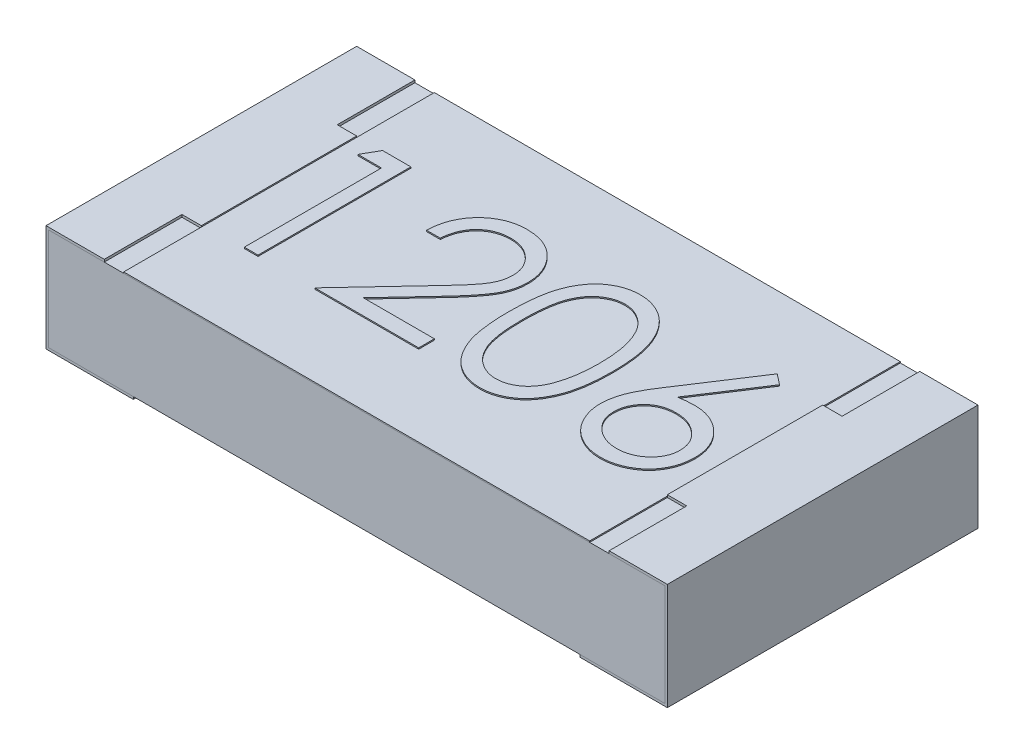
from build123d import *

# Parameters (mm, degrees)
CROQUIS1_W              = 3.2
CROQUIS1_H              = 1.6
SALIENTE_EXTRUIR1_DEPTH = 0.55
CROQUIS2_W              = 2.3
CROQUIS2_H              = 0.0125
CROQUIS2_W_2            = 2.4
CORTAR_EXTRUIR1_DEPTH   = 3.328626204
CROQUIS3_W              = 0.1
CROQUIS3_H              = 0.4
CORTAR_EXTRUIR3_DEPTH   = 0.0125
CROQUIS4_W              = 2.4
CROQUIS4_H              = 1.6
SALIENTE_EXTRUIR2_DEPTH = 0.00625
SALIENTE_EXTRUIR2_TAPER = 1
SALIENTE_EXTRUIR3_START = 0.54375
SALIENTE_EXTRUIR3_DEPTH = 0.00625


# Read off the part's stored shape, not the designer's step: Saliente-Extruir3
with BuildPart() as part:
    # Croquis1 → Saliente-Extruir1 (new body)
    with BuildSketch(Plane(origin=(0, 0, 0), x_dir=(1, 0, 0), z_dir=(0, 1, 0))):
        Rectangle(CROQUIS1_W, CROQUIS1_H)
    extrude(amount=SALIENTE_EXTRUIR1_DEPTH)

    # Croquis2 → Cortar-Extruir1 (cut, through all)
    with BuildSketch(Plane.XY.offset(0.8)):
        with Locations((0, 0.00625)):
            Rectangle(CROQUIS2_W, CROQUIS2_H)
        with Locations((0, 0.54375)):
            Rectangle(CROQUIS2_W_2, CROQUIS2_H)
    extrude(amount=-CORTAR_EXTRUIR1_DEPTH, mode=Mode.SUBTRACT)

    # Croquis3 → Cortar-Extruir3 (cut)
    with BuildSketch(Plane(origin=(0, 0.55, 0), x_dir=(1, 0, 0), z_dir=(0, 1, 0))):
        with Locations((-1.25, -0.6)):
            Rectangle(CROQUIS3_W, CROQUIS3_H)
        with Locations((-1.25, 0.6)):
            Rectangle(CROQUIS3_W, CROQUIS3_H)
        with Locations((1.25, 0.6)):
            Rectangle(CROQUIS3_W, CROQUIS3_H)
        with Locations((1.25, -0.6)):
            Rectangle(CROQUIS3_W, CROQUIS3_H)
    extrude(amount=-CORTAR_EXTRUIR3_DEPTH, mode=Mode.SUBTRACT)

    # Croquis4 → Saliente-Extruir2 (add)
    with BuildSketch(Plane(origin=(0, 0.5375, 0), x_dir=(1, 0, 0), z_dir=(0, 1, 0))):
        Rectangle(CROQUIS4_W, CROQUIS4_H)
    extrude(amount=SALIENTE_EXTRUIR2_DEPTH, taper=SALIENTE_EXTRUIR2_TAPER)

    # Saliente-Extruir3 outline → Saliente-Extruir3 (add)
    # profile 1 of 4: a face of its own
    with BuildSketch(Plane(origin=(0, 0, 0), x_dir=(1, 0, 0), z_dir=(0, 1, 0)).offset(SALIENTE_EXTRUIR3_START)):
        with BuildLine():
            add(Edge.make_bspline(
                [(-0.346873932, 0.341368482), (-0.353028949, 0.341207689), (-0.365116386, 0.340891918), (-0.382863306, 0.338683047), (-0.399793199, 0.33487235), (-0.415948649, 0.329660495), (-0.431356993, 0.323036002), (-0.445943298, 0.314784945), (-0.459674817, 0.30493913), (-0.472577365, 0.293776208), (-0.484465154, 0.281347904), (-0.494909897, 0.267493362), (-0.504036229, 0.252465544), (-0.511998882, 0.236305001), (-0.518465319, 0.218865091), (-0.523406532, 0.200207726), (-0.527316399, 0.180413914), (-0.528622591, 0.166744866), (-0.529292093, 0.159738644)],
                knots=[0, 0, 0, 0, 0.064438672, 0.126546911, 0.186887153, 0.245877536, 0.304040885, 0.362191218, 0.420975933, 0.480660283, 0.540600275, 0.600689098, 0.66193579, 0.724442506, 0.789038394, 0.856313757, 0.926352028, 1, 1, 1, 1], degree=3))
            add(Edge.make_bspline(
                [(-0.176122965, 0.181811715), (-0.176265927, 0.187182045), (-0.176547679, 0.197765935), (-0.179034279, 0.213283608), (-0.182792055, 0.228252373), (-0.188176746, 0.242718273), (-0.195284312, 0.256535867), (-0.203936015, 0.269721972), (-0.213918232, 0.282469905), (-0.225465851, 0.294422755), (-0.238151394, 0.305369943), (-0.251552653, 0.315067473), (-0.265731047, 0.32317177), (-0.280626797, 0.329815365), (-0.296198375, 0.33502693), (-0.312475897, 0.338638103), (-0.329414388, 0.340905402), (-0.340980497, 0.34121217), (-0.346873932, 0.341368482)],
                knots=[0, 0, 0, 0, 0.061965401, 0.122121906, 0.180988497, 0.239933216, 0.299905831, 0.359988847, 0.421775742, 0.486575826, 0.551534805, 0.615017543, 0.677258617, 0.739729962, 0.803050103, 0.866495132, 0.931973474, 1, 1, 1, 1], degree=3))
            add(Edge.make_bspline(
                [(-0.324958526, -0.059415413), (-0.317526881, -0.051657605), (-0.303252213, -0.036756444), (-0.283062352, -0.015001367), (-0.264928657, 0.005181064), (-0.248733743, 0.023752717), (-0.234828931, 0.040985244), (-0.222489536, 0.056320531), (-0.212602772, 0.07043244), (-0.201872771, 0.086789988), (-0.1914804, 0.106761661), (-0.182550082, 0.131168179), (-0.177104767, 0.156292849), (-0.176451542, 0.173271372), (-0.176122965, 0.181811715)],
                knots=[0, 0, 0, 0, 0.110802644, 0.212829202, 0.30610131, 0.390647321, 0.466924469, 0.534481039, 0.593586941, 0.644557005, 0.736200453, 0.825024026, 0.911985585, 1, 1, 1, 1], degree=3))
            Line((-0.324958526, -0.059415413), (-0.630197559, -0.385150868))
            Line((-0.630197559, -0.385150868), (-0.095398592, -0.385150868))
            Line((-0.095398592, -0.385150868), (-0.095398592, -0.304426496))
            Line((-0.095398592, -0.304426496), (-0.461653899, -0.304426496))
            Line((-0.461653899, -0.304426496), (-0.264730576, -0.094259332))
            add(Edge.make_bspline(
                [(-0.105489139, 0.188118307), (-0.105869911, 0.177156135), (-0.106624775, 0.155424164), (-0.113081921, 0.123488566), (-0.123166782, 0.092547241), (-0.13530944, 0.067645186), (-0.147558932, 0.047578801), (-0.158597487, 0.031057523), (-0.171519889, 0.013268678), (-0.186514219, -0.005728166), (-0.203270304, -0.026081809), (-0.221939916, -0.047779956), (-0.242656187, -0.070598424), (-0.25719627, -0.086183523), (-0.264730576, -0.094259332)],
                knots=[0, 0, 0, 0, 0.098702196, 0.195672309, 0.292422427, 0.391342544, 0.444462441, 0.504228775, 0.570352338, 0.642545753, 0.722287505, 0.807921123, 0.900469538, 1, 1, 1, 1], degree=3))
            add(Edge.make_bspline(
                [(-0.343247642, 0.422092854), (-0.334617371, 0.421890814), (-0.317659197, 0.421493812), (-0.292908997, 0.418084475), (-0.269347199, 0.412744684), (-0.247019859, 0.405252878), (-0.226105117, 0.395181979), (-0.206445857, 0.383084255), (-0.187808031, 0.369092568), (-0.171030828, 0.352619614), (-0.155625071, 0.33503385), (-0.142334449, 0.316259505), (-0.130952812, 0.296868691), (-0.121465856, 0.276713546), (-0.114482106, 0.255604295), (-0.109179955, 0.233848264), (-0.106182953, 0.211220256), (-0.105722988, 0.195904792), (-0.105489139, 0.188118307)],
                knots=[0, 0, 0, 0, 0.06947546, 0.136516798, 0.200788824, 0.263829673, 0.325735023, 0.387290692, 0.449509219, 0.51296782, 0.576275215, 0.6375801, 0.697902606, 0.757172088, 0.816598528, 0.876653171, 0.937289642, 1, 1, 1, 1], degree=3))
            add(Edge.make_bspline(
                [(-0.599925919, 0.159738644), (-0.599465566, 0.169109387), (-0.598561443, 0.187513276), (-0.594327431, 0.214346244), (-0.5882691, 0.239994321), (-0.579703283, 0.264251571), (-0.569065282, 0.287332477), (-0.556308115, 0.309145359), (-0.541197896, 0.329607006), (-0.524060903, 0.348527732), (-0.505448303, 0.365885289), (-0.485365626, 0.38087439), (-0.464262222, 0.393538828), (-0.442202116, 0.404126224), (-0.418936418, 0.412073273), (-0.394676257, 0.417969865), (-0.369315044, 0.421517572), (-0.352035641, 0.421898912), (-0.343247642, 0.422092854)],
                knots=[0, 0, 0, 0, 0.068790794, 0.135103289, 0.198978674, 0.2619043, 0.323494969, 0.385195378, 0.446969239, 0.509764777, 0.572250569, 0.633405176, 0.693251163, 0.752583163, 0.812579266, 0.873275085, 0.935549943, 1, 1, 1, 1], degree=3))
            Line((-0.599925919, 0.159738644), (-0.529292093, 0.159738644))
        make_face()
    # profile 2 of 4: a face of its own
    with BuildSketch(Plane(origin=(0, 0, 0), x_dir=(1, 0, 0), z_dir=(0, 1, 0)).offset(SALIENTE_EXTRUIR3_START)):
        with BuildLine():
            add(Edge.make_bspline(
                [(0.238377767, -0.405331962), (0.232170291, -0.40522709), (0.21993036, -0.405020303), (0.201793643, -0.402880903), (0.184189875, -0.399441326), (0.16703219, -0.394625266), (0.15023256, -0.388730204), (0.134019905, -0.381049893), (0.118213959, -0.372204643), (0.102856893, -0.362131271), (0.088237281, -0.350590305), (0.074272855, -0.337825434), (0.061314426, -0.323518117), (0.049253457, -0.307894266), (0.037790657, -0.291097621), (0.027246408, -0.27289885), (0.017493385, -0.253370114), (0.008578554, -0.232385246), (0.000674497, -0.209638028), (-0.006307358, -0.184868227), (-0.01181998, -0.157857219), (-0.016538523, -0.128821946), (-0.020344394, -0.097637641), (-0.022942673, -0.064287374), (-0.024548577, -0.028791926), (-0.024691388, -0.004444757), (-0.024764767, 0.008065117)],
                knots=[0, 0, 0, 0, 0.033787146, 0.066621658, 0.099284878, 0.131361165, 0.163585188, 0.196103927, 0.228902254, 0.262158056, 0.295991222, 0.330217846, 0.365059826, 0.400950737, 0.437620382, 0.475707529, 0.515380692, 0.556413541, 0.59976483, 0.646424156, 0.696431445, 0.749781518, 0.806573307, 0.867435532, 0.931886753, 1, 1, 1, 1], degree=3))
            add(Edge.make_bspline(
                [(0.5100342, 0.008065117), (0.509887675, -0.003971074), (0.509602176, -0.027423101), (0.50812279, -0.06172351), (0.505208717, -0.094105075), (0.501563495, -0.124645458), (0.496514834, -0.153217544), (0.490307121, -0.179920207), (0.483414629, -0.204868759), (0.474906528, -0.227858816), (0.465594293, -0.249211088), (0.455462504, -0.269150116), (0.444607825, -0.28785214), (0.432781929, -0.305167461), (0.420176916, -0.321218739), (0.406523001, -0.335722644), (0.392205076, -0.349028651), (0.377045706, -0.360868688), (0.361211906, -0.37123201), (0.345030106, -0.380499976), (0.32821319, -0.38797318), (0.311142262, -0.394389998), (0.293573142, -0.399292375), (0.275527732, -0.402682109), (0.257097821, -0.405059454), (0.244639392, -0.405240811), (0.238377767, -0.405331962)],
                knots=[0, 0, 0, 0, 0.06506329, 0.126773166, 0.185515763, 0.240764679, 0.292979796, 0.342250373, 0.388919286, 0.432775664, 0.474628433, 0.514774691, 0.553605893, 0.591426406, 0.62802812, 0.663803634, 0.698984336, 0.733591489, 0.767628469, 0.801208348, 0.83426384, 0.866980695, 0.899719742, 0.932701912, 0.966175883, 1, 1, 1, 1], degree=3))
            add(Edge.make_bspline(
                [(0.238377767, 0.422092854), (0.244637271, 0.421983157), (0.257085456, 0.421765003), (0.275489313, 0.419668281), (0.293468001, 0.416189212), (0.31094487, 0.411259732), (0.32806348, 0.405144103), (0.344689932, 0.397478761), (0.360927502, 0.388555975), (0.376518153, 0.378071428), (0.391633042, 0.366381912), (0.405900905, 0.353167655), (0.419323041, 0.338562084), (0.432067902, 0.322721468), (0.443773907, 0.305341981), (0.454921734, 0.286725902), (0.464899897, 0.26654767), (0.474509859, 0.245143959), (0.482804821, 0.22192254), (0.49028557, 0.19701431), (0.496329979, 0.17012506), (0.501364767, 0.14139587), (0.505265201, 0.110721232), (0.508105967, 0.078166901), (0.509606577, 0.04371146), (0.509889178, 0.020154035), (0.5100342, 0.008065117)],
                knots=[0, 0, 0, 0, 0.033788116, 0.067193932, 0.099862411, 0.132566612, 0.165151173, 0.197913187, 0.231319004, 0.265083278, 0.299255309, 0.334398567, 0.369942824, 0.406283561, 0.44406382, 0.482997707, 0.523354447, 0.56553659, 0.609612924, 0.656390811, 0.705885495, 0.7583245, 0.813831783, 0.872794559, 0.93472223, 1, 1, 1, 1], degree=3))
            add(Edge.make_bspline(
                [(-0.024764767, 0.008065117), (-0.024691004, 0.020680019), (-0.024547718, 0.045184648), (-0.022953709, 0.08089135), (-0.020305728, 0.114388801), (-0.016676836, 0.145678603), (-0.012260744, 0.174768835), (-0.006365536, 0.201581755), (0.000338619, 0.226241463), (0.008108602, 0.248828373), (0.016875982, 0.269646787), (0.026418388, 0.289081657), (0.037114523, 0.307103577), (0.048353083, 0.324000191), (0.060589, 0.339494912), (0.073474068, 0.353806558), (0.087511189, 0.366604365), (0.102223191, 0.378263304), (0.117743271, 0.388483756), (0.133629043, 0.397486119), (0.14998985, 0.405176816), (0.166870361, 0.411223803), (0.184118851, 0.416218468), (0.201795618, 0.419634084), (0.219929848, 0.421783194), (0.232170119, 0.421988655), (0.238377767, 0.422092854)],
                knots=[0, 0, 0, 0, 0.068594622, 0.133246042, 0.194312586, 0.251279223, 0.304513439, 0.354234907, 0.400480589, 0.443410755, 0.484014869, 0.523252301, 0.561042373, 0.597900239, 0.633518489, 0.668314351, 0.702495671, 0.736685354, 0.770293169, 0.803437255, 0.835912952, 0.868460246, 0.900846538, 0.933466525, 0.966257575, 1, 1, 1, 1], degree=3))
        make_face()
        with BuildLine():
            add(Edge.make_bspline(
                [(0.240742739, 0.341368482), (0.232037693, 0.34091166), (0.214611743, 0.339997185), (0.188875255, 0.333544788), (0.164205485, 0.322298121), (0.144586718, 0.309940704), (0.129550721, 0.298171124), (0.118962999, 0.287964844), (0.109035627, 0.276800641), (0.099890476, 0.264567008), (0.091325147, 0.251419606), (0.083458791, 0.237255005), (0.07637133, 0.222001425), (0.069830944, 0.205671801), (0.064080262, 0.187776034), (0.059336756, 0.168038978), (0.054954605, 0.146347106), (0.051852393, 0.122573428), (0.04909458, 0.096874225), (0.047322262, 0.069152233), (0.045943495, 0.039454251), (0.045894368, 0.018945836), (0.045869059, 0.008380446)],
                knots=[0, 0, 0, 0, 0.060386619, 0.120883249, 0.182754619, 0.24781103, 0.2812991, 0.315087624, 0.349702396, 0.384856581, 0.420966197, 0.458511188, 0.497174722, 0.537602048, 0.580503018, 0.62746754, 0.67838821, 0.733983221, 0.793746705, 0.857713672, 0.926697864, 1, 1, 1, 1], degree=3))
            add(Edge.make_bspline(
                [(0.439400374, 0.008380446), (0.43927665, 0.017840393), (0.43903462, 0.036346072), (0.438109487, 0.063447602), (0.43572051, 0.089188544), (0.433067183, 0.113679791), (0.429154982, 0.136785769), (0.42493682, 0.15869991), (0.419269696, 0.179150726), (0.413216111, 0.198458403), (0.406287622, 0.216403578), (0.39866082, 0.233069918), (0.39051545, 0.248537886), (0.381668363, 0.262765042), (0.372224582, 0.275815112), (0.361934851, 0.287426443), (0.351207329, 0.297958908), (0.336181812, 0.309981305), (0.316511027, 0.322239625), (0.292034358, 0.333520652), (0.266562618, 0.339998918), (0.24934316, 0.34091229), (0.240742739, 0.341368482)],
                knots=[0, 0, 0, 0, 0.065681198, 0.128486464, 0.18817513, 0.245106131, 0.299448425, 0.350822936, 0.399941681, 0.446671744, 0.491254533, 0.533376344, 0.573852755, 0.612526312, 0.649597136, 0.685532042, 0.720105786, 0.753837663, 0.818925416, 0.880493462, 0.940311334, 1, 1, 1, 1], degree=3))
            add(Edge.make_bspline(
                [(0.409601729, -0.189488865), (0.411974558, -0.182466076), (0.416792419, -0.168206803), (0.423001618, -0.146087273), (0.427891615, -0.122879547), (0.432290928, -0.09872232), (0.435293697, -0.073437438), (0.437710611, -0.047103136), (0.439134225, -0.019699558), (0.439310696, -0.001081031), (0.439400374, 0.008380446)],
                knots=[0, 0, 0, 0, 0.110588339, 0.224541754, 0.342503494, 0.464324098, 0.590756033, 0.722227475, 0.858842836, 1, 1, 1, 1], degree=3))
            add(Edge.make_bspline(
                [(0.240742739, -0.324607589), (0.249458372, -0.324248288), (0.266871643, -0.323530428), (0.292312609, -0.316604561), (0.317010696, -0.306154721), (0.336366126, -0.293798399), (0.351091516, -0.282031064), (0.361641976, -0.271998343), (0.371325555, -0.260764516), (0.380509918, -0.24864391), (0.388933529, -0.235404958), (0.396593479, -0.221111321), (0.403583348, -0.205723307), (0.40756567, -0.194981085), (0.409601729, -0.189488865)],
                knots=[0, 0, 0, 0, 0.112813401, 0.225393884, 0.339594815, 0.45967541, 0.52173519, 0.583925839, 0.648174145, 0.713881038, 0.781004455, 0.851450928, 0.924050693, 1, 1, 1, 1], degree=3))
            add(Edge.make_bspline(
                [(0.045869059, 0.008380446), (0.04589592, -0.002132169), (0.045948051, -0.022535091), (0.047309939, -0.052183349), (0.049165211, -0.079836307), (0.051558173, -0.105529075), (0.055111861, -0.129174688), (0.059093676, -0.150935774), (0.063939303, -0.170697171), (0.069672496, -0.188594483), (0.076202664, -0.204931445), (0.083332522, -0.22013327), (0.090991928, -0.23437954), (0.099563973, -0.247542287), (0.108899675, -0.259664438), (0.118788163, -0.270960548), (0.129598487, -0.28103427), (0.144553519, -0.293116099), (0.164296754, -0.305600966), (0.189172533, -0.316472795), (0.21473373, -0.323305051), (0.232083121, -0.324173913), (0.240742739, -0.324607589)],
                knots=[0, 0, 0, 0, 0.072951066, 0.141583694, 0.20592646, 0.265301357, 0.320597233, 0.371816503, 0.41878977, 0.461698729, 0.502133582, 0.540804315, 0.578180525, 0.614296865, 0.649678243, 0.68429946, 0.718358953, 0.752080865, 0.817652439, 0.879722076, 0.93996556, 1, 1, 1, 1], degree=3))
        make_face(mode=Mode.SUBTRACT)
    # profile 3 of 4: a face of its own
    with BuildSketch(Plane(origin=(0, 0, 0), x_dir=(1, 0, 0), z_dir=(0, 1, 0)).offset(SALIENTE_EXTRUIR3_START)):
        with BuildLine():
            add(Edge.make_bspline(
                [(0.621030212, -0.165681481), (0.621295889, -0.157575954), (0.621838352, -0.141026017), (0.62562601, -0.11596054), (0.631712207, -0.090313298), (0.638528224, -0.068555695), (0.645729985, -0.050731758), (0.651723475, -0.036361458), (0.659183479, -0.021573434), (0.667138069, -0.005860598), (0.676303272, 0.010372104), (0.686268755, 0.02739597), (0.697310041, 0.044940254), (0.705050276, 0.056846082), (0.709007164, 0.062932464)],
                knots=[0, 0, 0, 0, 0.09781819, 0.199726053, 0.305276357, 0.415811491, 0.474472231, 0.53727388, 0.603657421, 0.674298863, 0.749834485, 0.828598477, 0.912377778, 1, 1, 1, 1], degree=3))
            add(Edge.make_bspline(
                [(0.859419374, -0.405331962), (0.848828501, -0.404988306), (0.827849838, -0.404307585), (0.796989608, -0.398243619), (0.767336907, -0.388414983), (0.739099488, -0.374874294), (0.712941886, -0.357770775), (0.689540122, -0.337180704), (0.669010881, -0.313544209), (0.651926085, -0.286864957), (0.6383754, -0.258195648), (0.628213314, -0.2283014), (0.622277458, -0.197291137), (0.621447994, -0.176269562), (0.621030212, -0.165681481)],
                knots=[0, 0, 0, 0, 0.084334722, 0.167052318, 0.249566077, 0.332740482, 0.415914886, 0.49782801, 0.580372589, 0.664600121, 0.749466693, 0.832510234, 0.915639282, 1, 1, 1, 1], degree=3))
            add(Edge.make_bspline(
                [(1.105376445, -0.164262498), (1.105056425, -0.175276811), (1.104426699, -0.196950372), (1.098151832, -0.228517589), (1.088401331, -0.258590693), (1.074464132, -0.286689542), (1.057152715, -0.312775624), (1.036041988, -0.33588951), (1.01188063, -0.356503813), (0.984561282, -0.373741973), (0.955160453, -0.387819836), (0.924273417, -0.397931397), (0.892200132, -0.404156718), (0.870431192, -0.40493717), (0.859419374, -0.405331962)],
                knots=[0, 0, 0, 0, 0.085947943, 0.169125212, 0.250399107, 0.332289736, 0.413364288, 0.494172283, 0.576021735, 0.660756969, 0.745783126, 0.830043593, 0.914027546, 1, 1, 1, 1], degree=3))
            add(Edge.make_bspline(
                [(0.871874892, 0.068923726), (0.879874258, 0.06870872), (0.895620773, 0.068285488), (0.918739457, 0.065028431), (0.940954622, 0.059895633), (0.962174193, 0.052413534), (0.982474333, 0.042855815), (1.001971538, 0.031400935), (1.020299305, 0.017457405), (1.037693655, 0.001881446), (1.053485976, -0.015370289), (1.067467819, -0.033675418), (1.07921232, -0.053014869), (1.088741158, -0.073378848), (1.096140643, -0.094735963), (1.101534866, -0.117058889), (1.104723502, -0.14036302), (1.105156497, -0.156211803), (1.105376445, -0.164262498)],
                knots=[0, 0, 0, 0, 0.065230804, 0.128404896, 0.190067072, 0.250943366, 0.311545833, 0.372862802, 0.435023674, 0.499071725, 0.563091075, 0.625510106, 0.686680036, 0.747282503, 0.808563495, 0.870742104, 0.934340952, 1, 1, 1, 1], degree=3))
            add(Edge.make_bspline(
                [(0.790362196, 0.061355816), (0.804207814, 0.063562708), (0.831215258, 0.067867501), (0.858552394, 0.068577644), (0.871874892, 0.068923726)],
                knots=[0, 0, 0, 0, 0.512659336, 1, 1, 1, 1], degree=3))
            Line((0.790362196, 0.061355816), (0.998322053, 0.379365696))
            Line((0.998322053, 0.379365696), (0.943927701, 0.422092854))
            Line((0.943927701, 0.422092854), (0.709007164, 0.062932464))
        make_face()
        with BuildLine():
            add(Edge.make_bspline(
                [(1.03474262, -0.168519448), (1.034618872, -0.16314616), (1.034375997, -0.152600143), (1.031628935, -0.137154012), (1.027819018, -0.122239129), (1.022066033, -0.107949231), (1.014591964, -0.09434071), (1.005488256, -0.081344821), (0.99495678, -0.06886193), (0.982791594, -0.057266741), (0.969548651, -0.046664541), (0.955467968, -0.037305341), (0.94073686, -0.029406611), (0.925370263, -0.022816175), (0.909192104, -0.018060186), (0.892463574, -0.014315288), (0.874970715, -0.012322441), (0.863102573, -0.011976794), (0.857054402, -0.011800647)],
                knots=[0, 0, 0, 0, 0.061137915, 0.119993844, 0.178225322, 0.23625642, 0.294929377, 0.354715749, 0.416729664, 0.480664408, 0.54583177, 0.609758105, 0.672971228, 0.736016869, 0.799839398, 0.864775357, 0.931087623, 1, 1, 1, 1], degree=3))
            add(Edge.make_bspline(
                [(0.863203328, -0.324607589), (0.869042321, -0.324434638), (0.880493375, -0.324095456), (0.89739801, -0.322053665), (0.913606624, -0.318441127), (0.92913346, -0.313311104), (0.944096967, -0.307047523), (0.958287644, -0.299124743), (0.971786463, -0.28968986), (0.984550505, -0.279093652), (0.996386564, -0.26754118), (1.006568294, -0.255121394), (1.015267187, -0.242147477), (1.022335951, -0.228610474), (1.02797161, -0.214414229), (1.031821801, -0.199636178), (1.0343245, -0.184265513), (1.034601404, -0.173837535), (1.03474262, -0.168519448)],
                knots=[0, 0, 0, 0, 0.067962371, 0.133283403, 0.197835298, 0.260891987, 0.323376504, 0.386350075, 0.449637731, 0.514795327, 0.579239913, 0.641814178, 0.701358565, 0.760726766, 0.819222068, 0.878716169, 0.938147354, 1, 1, 1, 1], degree=3))
            add(Edge.make_bspline(
                [(0.691664037, -0.168519448), (0.69180489, -0.173837738), (0.692081082, -0.184266113), (0.694588961, -0.199633888), (0.698419725, -0.214422775), (0.704118148, -0.22855653), (0.71091542, -0.242250592), (0.719889132, -0.255008941), (0.729832383, -0.267606457), (0.741717913, -0.279075414), (0.754473582, -0.289747225), (0.768101279, -0.299075098), (0.782304378, -0.307055053), (0.797274629, -0.313309074), (0.812799638, -0.318441687), (0.829008755, -0.322053512), (0.845913254, -0.324095496), (0.857364326, -0.324434651), (0.863203328, -0.324607589)],
                knots=[0, 0, 0, 0, 0.061841703, 0.121262373, 0.180745949, 0.239230902, 0.298307559, 0.358182798, 0.420359231, 0.484792416, 0.549938484, 0.613718278, 0.676680707, 0.73915417, 0.802199703, 0.866740178, 0.932049652, 1, 1, 1, 1], degree=3))
            add(Edge.make_bspline(
                [(0.857054402, -0.011800647), (0.851058728, -0.011975609), (0.839347437, -0.012317362), (0.822165317, -0.014301941), (0.805903871, -0.018039154), (0.790347661, -0.022798934), (0.775787519, -0.029343485), (0.762117626, -0.037293222), (0.749285121, -0.046652786), (0.737424412, -0.05728958), (0.726670964, -0.068935416), (0.717410356, -0.081409127), (0.709422254, -0.094410098), (0.702927454, -0.108046957), (0.697869998, -0.122314491), (0.694211674, -0.13714708), (0.692175712, -0.152644187), (0.691836998, -0.16315316), (0.691664037, -0.168519448)],
                knots=[0, 0, 0, 0, 0.070599289, 0.137900921, 0.203196198, 0.266789725, 0.329106387, 0.390653545, 0.452653057, 0.51574804, 0.577926341, 0.638930012, 0.698350718, 0.757296037, 0.816393767, 0.87626691, 0.936817109, 1, 1, 1, 1], degree=3))
        make_face(mode=Mode.SUBTRACT)
    # profile 4 of 4: a face of its own
    with BuildSketch(Plane(origin=(0, 0, 0), x_dir=(1, 0, 0), z_dir=(0, 1, 0)).offset(SALIENTE_EXTRUIR3_START)):
        Polygon((-0.922823408, 0.401911761), (-1.068348009, 0.401911761), (-1.114543792, 0.321187389), (-0.993457234, 0.321187389), (-0.993457234, -0.385150868), (-0.922823408, -0.385150868), align=None)
    extrude(amount=SALIENTE_EXTRUIR3_DEPTH)


solid = part.part
